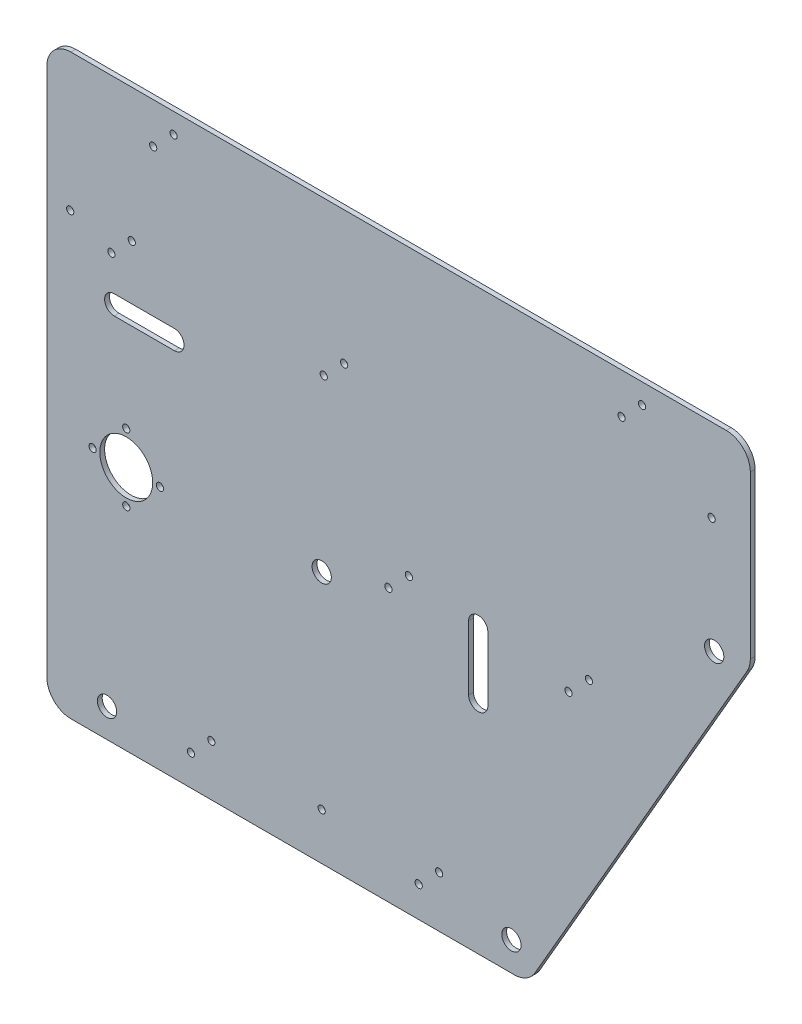
from build123d import *

# Parameters (mm, degrees)
BOSS_EXTRUDE1_DEPTH = 2
SKETCH2_R           = 4
SKETCH2_R_2         = 11
SKETCH2_R_3         = 1.5
CUT_EXTRUDE1_DEPTH  = 3
SKETCH4_W           = 292.37604307
SKETCH4_H           = 50
BOSS_EXTRUDE2_DEPTH = 2
FILLET1_R           = 10
SKETCH5_R           = 1.5
CUT_EXTRUDE2_DEPTH  = 11


with BuildPart() as part:
    # Sketch1 → Boss-Extrude1 (new body)
    with BuildSketch(Plane.XY):
        Polygon((-100, 110), (-100, -80), (100, -80), (192.37604307, 80), (192.37604307, 110), align=None)
    extrude(amount=BOSS_EXTRUDE1_DEPTH)

    # Sketch2 → Cut-Extrude1 (cut)
    with BuildSketch(Plane.XY.offset(2)):
        with Locations((93.07179677, -68)):
            Circle(SKETCH2_R)
        with Locations((177.364936071, 78)):
            Circle(SKETCH2_R)
        with Locations((-67, 22)):
            Circle(SKETCH2_R_2)
        with Locations((-75, -68)):
            Circle(SKETCH2_R)
        with Locations((-53, 22)):
            Circle(SKETCH2_R_3)
        with Locations((-67, 36)):
            Circle(SKETCH2_R_3)
        with Locations((-81, 22)):
            Circle(SKETCH2_R_3)
        with Locations((-67, 8)):
            Circle(SKETCH2_R_3)
        with Locations((54.54952947, -67.242640687)):
            Circle(SKETCH2_R_3)
        with Locations((63.034810844, -58.757359313)):
            Circle(SKETCH2_R_3)
        with Locations((14.225855729, -60.5)):
            Circle(SKETCH2_R_3)
        with Locations((-40.127135228, -67.242640687)):
            Circle(SKETCH2_R_3)
        with Locations((-31.641853854, -58.757359313)):
            Circle(SKETCH2_R_3)
        with Locations((-90.295627115, 102.881439108)):
            Circle(SKETCH2_R_3)
        with Locations((-73.186266887, 96.138798421)):
            Circle(SKETCH2_R_3)
        with Locations((-64.700985513, 104.624079796)):
            Circle(SKETCH2_R_3)
        with Locations((15.078196993, 96.138798421)):
            Circle(SKETCH2_R_3)
        with Locations((23.563478368, 104.624079796)):
            Circle(SKETCH2_R_3)
        with Locations((41.969500075, 33.138798421)):
            Circle(SKETCH2_R_3)
        with Locations((50.454781449, 41.624079796)):
            Circle(SKETCH2_R_3)
        with Locations((116.811272287, 33.138798421)):
            Circle(SKETCH2_R_3)
        with Locations((125.296553661, 41.624079796)):
            Circle(SKETCH2_R_3)
        with Locations((14.225855729, 25)):
            Circle(SKETCH2_R)
        with Locations((176.305585362, 125.488938255)):
            Circle(SKETCH2_R_3)
        with Locations((-55.814717647, 143.138798421)):
            Circle(SKETCH2_R_3)
        with Locations((-47.329436273, 151.624079796)):
            Circle(SKETCH2_R_3)
        with Locations((138.89162595, 143.138798421)):
            Circle(SKETCH2_R_3)
        with Locations((147.376907324, 151.624079796)):
            Circle(SKETCH2_R_3)
        with BuildLine():
            Line((75.290389443, 11.241781095), (75.290389443, 37.908558601))
            ThreePointArc((75.290389443, 37.908558601), (79.290389443, 41.908558601), (83.290389443, 37.908558601))
            Line((83.290389443, 37.908558601), (83.290389443, 11.241781095))
            ThreePointArc((83.290389443, 11.241781095), (79.290389443, 7.241781095), (75.290389443, 11.241781095))
        make_face()
        with BuildLine():
            Line((-72, 82), (-47, 82))
            ThreePointArc((-47, 82), (-43, 78), (-47, 74))
            Line((-47, 74), (-72, 74))
            ThreePointArc((-72, 74), (-76, 78), (-72, 82))
        make_face()
    extrude(amount=-CUT_EXTRUDE1_DEPTH, mode=Mode.SUBTRACT)

    # Sketch4 → Boss-Extrude2 (add)
    with BuildSketch(Plane.XY.offset(2)):
        with Locations((46.188021535, 135)):
            Rectangle(SKETCH4_W, SKETCH4_H)
    extrude(amount=-BOSS_EXTRUDE2_DEPTH)

    # Fillet1
    fillet1_edges = [part.edges().sort_by_distance(p)[0] for p in [
        (192.37604307, 160, 1),
        (192.37604307, 80, 1),
        (100, -80, 1),
        (-100, -80, 1),
        (-100, 160, 1),
    ]]
    fillet(fillet1_edges, radius=FILLET1_R)

    # Sketch5 → Cut-Extrude2 (cut)
    with BuildSketch(Plane.XY.offset(2)):
        with Locations((-55.814717647, 143.138798421)):
            Circle(SKETCH5_R)
        with Locations((-47.329436273, 151.624079796)):
            Circle(SKETCH5_R)
        with Locations((138.89162595, 143.138798421)):
            Circle(SKETCH5_R)
        with Locations((147.376907324, 151.624079796)):
            Circle(SKETCH5_R)
        with Locations((176.305585362, 125.488938255)):
            Circle(SKETCH5_R)
    extrude(amount=-CUT_EXTRUDE2_DEPTH, mode=Mode.SUBTRACT)


solid = part.part
